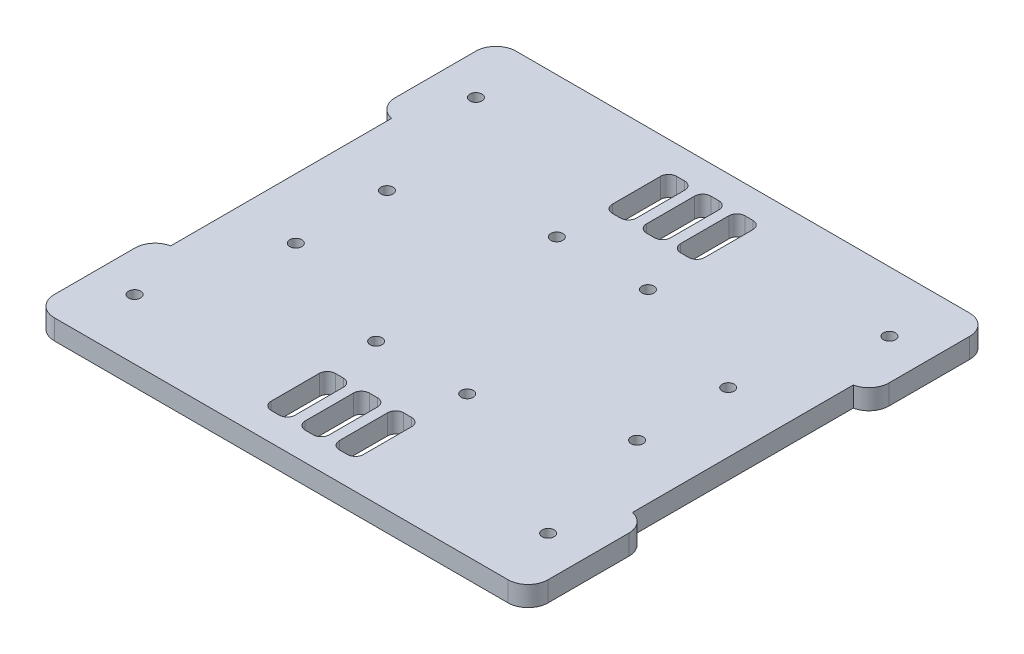
from build123d import *

# Parameters (mm, degrees)
RESSALTO_EXTRUS_O1_DEPTH = 5
FILETE1_R                = 5
ESBO_O3_R                = 1.5
CORTE_EXTRUS_O1_DEPTH    = 5
ESBO_O5_R                = 1.5
CORTE_EXTRUS_O2_DEPTH    = 10


with BuildPart() as part:
    # Esboço1 → Ressalto-extrusão1 (new body)
    with BuildSketch(Plane(origin=(0, 0, 0), x_dir=(1, 0, 0), z_dir=(0, 1, 0))):
        with BuildLine():
            Line((81.90590785, -20.429188404), (85.90590785, -20.429188404))
            Line((85.90590785, -20.429188404), (85.90590785, 4.570811596))
            ThreePointArc((85.90590785, 4.570811596), (84.441441756, 8.106345502), (80.90590785, 9.570811596))
            Line((80.90590785, 9.570811596), (-32.09409215, 9.570811596))
            ThreePointArc((-32.09409215, 9.570811596), (-35.629626056, 8.106345502), (-37.09409215, 4.570811596))
            Line((-37.09409215, 4.570811596), (-37.09409215, -20.429188404))
            Line((-37.09409215, -20.429188404), (-33.09409215, -20.429188404))
            Line((-33.09409215, -20.429188404), (-33.09409215, -75.429188404))
            Line((-33.09409215, -75.429188404), (-37.09409215, -75.429188404))
            Line((-37.09409215, -75.429188404), (-37.09409215, -100.429188404))
            ThreePointArc((-37.09409215, -100.429188404), (-35.629626056, -103.96472231), (-32.09409215, -105.429188404))
            Line((-32.09409215, -105.429188404), (80.90590785, -105.429188404))
            ThreePointArc((80.90590785, -105.429188404), (84.441441756, -103.96472231), (85.90590785, -100.429188404))
            Line((85.90590785, -100.429188404), (85.90590785, -75.429188404))
            Line((85.90590785, -75.429188404), (81.90590785, -75.429188404))
            Line((81.90590785, -75.429188404), (81.90590785, -20.429188404))
        make_face()
    extrude(amount=RESSALTO_EXTRUS_O1_DEPTH)

    # Filete1
    # the kernel refuses this fillet: 5 mm, written as the material it takes off along each edge
    with BuildSketch(Plane(origin=(-37.09409215, -12.247448714, 75.429188404), x_dir=(1.0, 0, 1.5738521597081158e-12), z_dir=(0, 1, 0)), Plane(origin=(85.90590785, -12.247448714, 20.429188404), x_dir=(-1.0, 0, -1.5685230891899197e-12), z_dir=(0, 1, 0))) as filete1_piece_1:
        with BuildLine():
            CenterArc((5, -4.898979486), FILETE1_R, 101.536959033, 78.463040967)
            Line((0, -4.898979486), (-0.1, -4.898979486))
            Line((-0.1, -4.898979486), (-0.1, 0))
            Line((-0.1, 0), (0, 0.1))
            ThreePointArc((0, 0.1), (2, 0.1), (3.98, 0.09797959))
            Line((3.98, 0.09797959), (4, 0))
        make_face()
    extrude(amount=29.494897428, mode=Mode.SUBTRACT)
    with BuildSketch(Plane(origin=(-37.09409215, -12.247448714, 20.429188404), x_dir=(0, 0, -1), z_dir=(0, 1, 0)), Plane(origin=(85.90590785, -12.247448714, 75.429188404), x_dir=(0, 0, 1), z_dir=(0, 1, 0))) as filete1_piece_2:
        with BuildLine():
            CenterArc((4.898979486, -5), FILETE1_R, 90, 78.463040967)
            Line((0, -4), (-0.09797959, -3.98))
            ThreePointArc((-0.09797959, -3.98), (-0.1, -2), (-0.1, 0))
            Line((-0.1, 0), (0, 0.1))
            Line((0, 0.1), (4.898979486, 0.1))
            Line((4.898979486, 0.1), (4.898979486, 0))
        make_face()
    extrude(amount=29.494897428, mode=Mode.SUBTRACT)

    # Esboço3 → Corte-extrusão1 (cut)
    with BuildSketch(Plane.XZ):
        with Locations(Location((-27.09409215, 5.429188404, 0), (0, 0, 270))):
            Circle(ESBO_O3_R)
        with Locations(Location((75.90590785, 5.429188404, 0), (0, 0, 270))):
            Circle(ESBO_O3_R)
        with Locations(Location((75.90590785, 90.429188404, 0), (0, 0, 90))):
            Circle(ESBO_O3_R)
        with Locations(Location((-27.09409215, 90.429188404, 0), (0, 0, 90))):
            Circle(ESBO_O3_R)
        with BuildLine():
            Line((35.90590785, 84.429188404), (35.90590785, 96.429188404))
            ThreePointArc((35.90590785, 96.429188404), (35.320121412, 97.843401966), (33.90590785, 98.429188404))
            Line((33.90590785, 98.429188404), (31.90590785, 98.429188404))
            ThreePointArc((31.90590785, 98.429188404), (30.491694287, 97.843401966), (29.90590785, 96.429188404))
            Line((29.90590785, 96.429188404), (29.90590785, 84.429188404))
            ThreePointArc((29.90590785, 84.429188404), (30.491694287, 83.014974841), (31.90590785, 82.429188404))
            Line((31.90590785, 82.429188404), (33.90590785, 82.429188404))
            ThreePointArc((33.90590785, 82.429188404), (35.320121412, 83.014974841), (35.90590785, 84.429188404))
        make_face()
        with BuildLine():
            Line((14.90590785, 13.429188404), (16.90590785, 13.429188404))
            ThreePointArc((16.90590785, 13.429188404), (18.320121412, 12.843401966), (18.90590785, 11.429188404))
            Line((18.90590785, 11.429188404), (18.90590785, -0.570811596))
            ThreePointArc((18.90590785, -0.570811596), (18.320121412, -1.985025159), (16.90590785, -2.570811596))
            Line((16.90590785, -2.570811596), (14.90590785, -2.570811596))
            ThreePointArc((14.90590785, -2.570811596), (13.491694287, -1.985025159), (12.90590785, -0.570811596))
            Line((12.90590785, -0.570811596), (12.90590785, 11.429188404))
            ThreePointArc((12.90590785, 11.429188404), (13.491694287, 12.843401966), (14.90590785, 13.429188404))
        make_face()
        with BuildLine():
            Line((23.40590785, 13.429188404), (25.40590785, 13.429188404))
            ThreePointArc((25.40590785, 13.429188404), (26.820121412, 12.843401966), (27.40590785, 11.429188404))
            Line((27.40590785, 11.429188404), (27.40590785, -0.570811596))
            ThreePointArc((27.40590785, -0.570811596), (26.820121412, -1.985025159), (25.40590785, -2.570811596))
            Line((25.40590785, -2.570811596), (23.40590785, -2.570811596))
            ThreePointArc((23.40590785, -2.570811596), (21.991694287, -1.985025159), (21.40590785, -0.570811596))
            Line((21.40590785, -0.570811596), (21.40590785, 11.429188404))
            ThreePointArc((21.40590785, 11.429188404), (21.991694287, 12.843401966), (23.40590785, 13.429188404))
        make_face()
        with BuildLine():
            Line((31.90590785, 13.429188404), (33.90590785, 13.429188404))
            ThreePointArc((33.90590785, 13.429188404), (35.320121412, 12.843401966), (35.90590785, 11.429188404))
            Line((35.90590785, 11.429188404), (35.90590785, -0.570811596))
            ThreePointArc((35.90590785, -0.570811596), (35.320121412, -1.985025159), (33.90590785, -2.570811596))
            Line((33.90590785, -2.570811596), (31.90590785, -2.570811596))
            ThreePointArc((31.90590785, -2.570811596), (30.491694287, -1.985025159), (29.90590785, -0.570811596))
            Line((29.90590785, -0.570811596), (29.90590785, 11.429188404))
            ThreePointArc((29.90590785, 11.429188404), (30.491694287, 12.843401966), (31.90590785, 13.429188404))
        make_face()
        with BuildLine():
            Line((27.40590785, 84.429188404), (27.40590785, 96.429188404))
            ThreePointArc((27.40590785, 96.429188404), (26.820121412, 97.843401966), (25.40590785, 98.429188404))
            Line((25.40590785, 98.429188404), (23.40590785, 98.429188404))
            ThreePointArc((23.40590785, 98.429188404), (21.991694287, 97.843401966), (21.40590785, 96.429188404))
            Line((21.40590785, 96.429188404), (21.40590785, 84.429188404))
            ThreePointArc((21.40590785, 84.429188404), (21.991694287, 83.014974841), (23.40590785, 82.429188404))
            Line((23.40590785, 82.429188404), (25.40590785, 82.429188404))
            ThreePointArc((25.40590785, 82.429188404), (26.820121412, 83.014974841), (27.40590785, 84.429188404))
        make_face()
        with BuildLine():
            Line((18.90590785, 84.429188404), (18.90590785, 96.429188404))
            ThreePointArc((18.90590785, 96.429188404), (18.320121412, 97.843401966), (16.90590785, 98.429188404))
            Line((16.90590785, 98.429188404), (14.90590785, 98.429188404))
            ThreePointArc((14.90590785, 98.429188404), (13.491694287, 97.843401966), (12.90590785, 96.429188404))
            Line((12.90590785, 96.429188404), (12.90590785, 84.429188404))
            ThreePointArc((12.90590785, 84.429188404), (13.491694287, 83.014974841), (14.90590785, 82.429188404))
            Line((14.90590785, 82.429188404), (16.90590785, 82.429188404))
            ThreePointArc((16.90590785, 82.429188404), (18.320121412, 83.014974841), (18.90590785, 84.429188404))
        make_face()
    extrude(amount=-CORTE_EXTRUS_O1_DEPTH, mode=Mode.SUBTRACT)

    # Esboço5 → Corte-extrusão2 (cut)
    with BuildSketch(Plane.XZ):
        with Locations(Location((13.05590785, 25.429188404, 0), (0, 0, 270))):
            Circle(ESBO_O5_R)
        with Locations(Location((35.75590785, 25.429188404, 0), (0, 0, 270))):
            Circle(ESBO_O5_R)
        with Locations(Location((-18.09409215, 59.279188404, 0), (0, 0, 270))):
            Circle(ESBO_O5_R)
        with Locations(Location((-18.09409215, 36.579188404, 0), (0, 0, 270))):
            Circle(ESBO_O5_R)
        with Locations(Location((13.05590785, 70.429188404, 0), (0, 0, 90))):
            Circle(ESBO_O5_R)
        with Locations(Location((35.75590785, 70.429188404, 0), (0, 0, 90))):
            Circle(ESBO_O5_R)
        with Locations(Location((66.90590785, 36.579188404, 0), (0, 0, 90))):
            Circle(ESBO_O5_R)
        with Locations(Location((66.90590785, 59.279188404, 0), (0, 0, 90))):
            Circle(ESBO_O5_R)
    extrude(amount=-CORTE_EXTRUS_O2_DEPTH, mode=Mode.SUBTRACT)


solid = part.part
